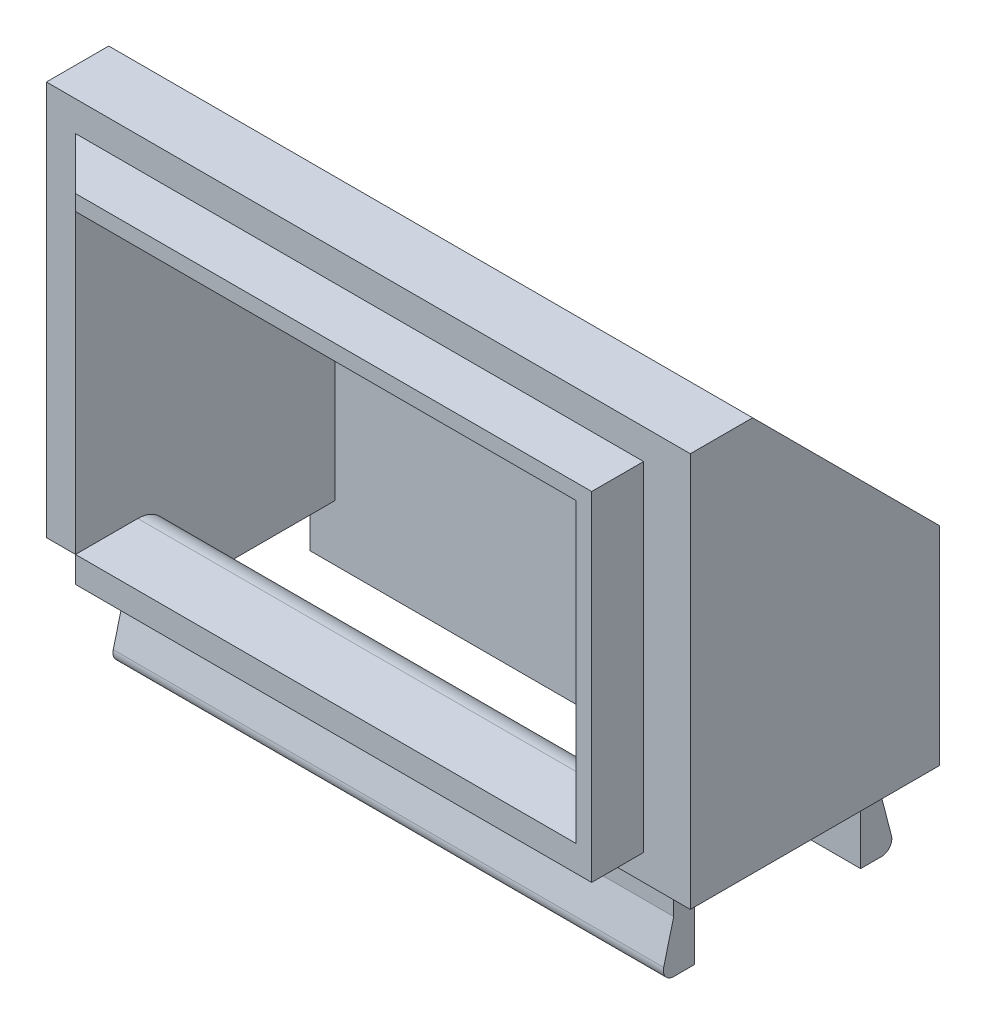
from build123d import *

# Parameters (mm, degrees)
SKETCH1_W           = 31
SKETCH1_H           = 12
BOSS_EXTRUDE1_DEPTH = 19
SKETCH2_W           = 24.1
SKETCH2_H           = 8
CUT_EXTRUDE1_DEPTH  = 16.8
SKETCH3_W           = 24.1
SKETCH3_H           = 14.3
CUT_EXTRUDE2_DEPTH  = 2
FILLET1_SIZE        = 8
FILLET2_SIZE        = 9
SKETCH6_W           = 26.5
SKETCH6_H           = 1
BOSS_EXTRUDE3_DEPTH = 4.2
BOSS_EXTRUDE6_DEPTH = 26.5
SKETCH15_W          = 1.2
SKETCH15_H          = 8
BOSS_EXTRUDE7_DEPTH = 1.5
SKETCH4_W           = 27.35
SKETCH4_H           = 16.3
SKETCH4_W_2         = 24.1
SKETCH4_H_2         = 14.3
BOSS_EXTRUDE2_DEPTH = 2.5
CHAMFER1_SIZE       = 2.5
FILLET3_R           = 1.5


with BuildPart() as part:
    # Sketch1 → Boss-Extrude1 (new body)
    with BuildSketch(Plane(origin=(0, 0, 0), x_dir=(1, 0, 0), z_dir=(0, 1, 0))):
        Rectangle(SKETCH1_W, SKETCH1_H)
    extrude(amount=BOSS_EXTRUDE1_DEPTH)

    # Sketch2 → Cut-Extrude1 (cut)
    with BuildSketch(Plane.XZ):
        with Locations((0.45, 0)):
            Rectangle(SKETCH2_W, SKETCH2_H)
    extrude(amount=-CUT_EXTRUDE1_DEPTH, mode=Mode.SUBTRACT)

    # Sketch3 → Cut-Extrude2 (cut)
    with BuildSketch(Plane.XY.offset(6)):
        with Locations((0.45, 9.65)):
            Rectangle(SKETCH3_W, SKETCH3_H)
    extrude(amount=-CUT_EXTRUDE2_DEPTH, mode=Mode.SUBTRACT)

    # Fillet1
    fillet1_edges = [part.edges().sort_by_distance(p)[0] for p in [
        (0.45, 16.8, -4),
    ]]
    chamfer(fillet1_edges, length=FILLET1_SIZE)

    # Fillet2
    fillet2_edges = [part.edges().sort_by_distance(p)[0] for p in [
        (0, 19, -6),
    ]]
    chamfer(fillet2_edges, length=FILLET2_SIZE)

    # Sketch6 → Boss-Extrude3 (add)
    with BuildSketch(Plane.XZ):
        with Locations((0.45, 4.5)):
            Rectangle(SKETCH6_W, SKETCH6_H)
        with Locations((0.45, -4.5)):
            Rectangle(SKETCH6_W, SKETCH6_H)
    extrude(amount=BOSS_EXTRUDE3_DEPTH)

    # Sketch14 → Boss-Extrude6 (add)
    with BuildSketch(Plane(origin=(13.7, 0, 0), x_dir=(0, 0, -1), z_dir=(1, 0, 0))):
        with BuildLine():
            Line((5.484122918, -3.575), (5, -1.7))
            Line((5, -1.7), (5, -4.2))
            ThreePointArc((5, -4.2), (5.395284708, -4.006186218), (5.484122918, -3.575))
        make_face()
        with BuildLine():
            Line((-5, -4.2), (-5, -1.7))
            Line((-5, -1.7), (-5.484122918, -3.575))
            ThreePointArc((-5.484122918, -3.575), (-5.395284708, -4.006186218), (-5, -4.2))
        make_face()
    extrude(amount=-BOSS_EXTRUDE6_DEPTH)

    # Sketch15 → Boss-Extrude7 (add)
    with BuildSketch(Plane.XZ):
        with Locations((-12.2, 0)):
            Rectangle(SKETCH15_W, SKETCH15_H)
        with Locations((13.1, 0)):
            Rectangle(SKETCH15_W, SKETCH15_H)
    extrude(amount=BOSS_EXTRUDE7_DEPTH)

    # Sketch4 → Boss-Extrude2 (add)
    with BuildSketch(Plane.XY.offset(6)):
        with Locations((-0.425, 9.4)):
            Rectangle(SKETCH4_W, SKETCH4_H)
        with Locations((0.45, 9.65)):
            Rectangle(SKETCH4_W_2, SKETCH4_H_2, mode=Mode.SUBTRACT)
    extrude(amount=BOSS_EXTRUDE2_DEPTH)

    # Chamfer1
    chamfer1_edges = [part.edges().sort_by_distance(p)[0] for p in [
        (-14.1, 9.4, 8.5),
    ]]
    chamfer(chamfer1_edges, length=CHAMFER1_SIZE - 0.0001)  # a hair under: the kernel refuses the full size

    # Fillet3
    fillet3_edges = [part.edges().sort_by_distance(p)[0] for p in [
        (0.45, 2.5, 4),
    ]]
    fillet(fillet3_edges, radius=FILLET3_R)


solid = part.part
